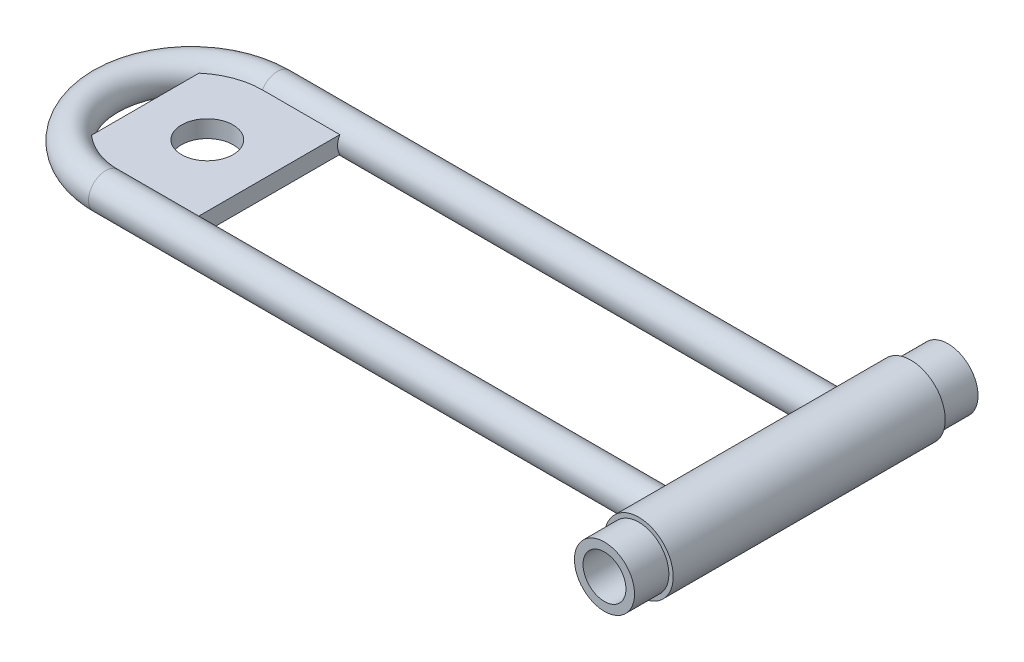
from build123d import *
from build123d.topology import SkipClean

# Parameters (mm, degrees)
SKETCH1_R           = 6.35
SKETCH1_R_2         = 3.175
BOSS_EXTRUDE1_DEPTH = 62.992
SKETCH3_R           = 3.175
SKETCH6_W           = 22.86
SKETCH6_H           = 3.175
BOSS_EXTRUDE3_DEPTH = 29.21
SKETCH7_R           = 4.7625
CUT_EXTRUDE1_DEPTH  = 29.21
BOSS_EXTRUDE5_START = 6.35
SKETCH9_R           = 6.35
SKETCH9_R_2         = 3.175
BOSS_EXTRUDE5_DEPTH = 6.35
CUT_EXTRUDE6_START  = -12.7
SKETCH10_R          = 6.35
SKETCH10_R_2        = 5.55625
CUT_EXTRUDE6_DEPTH  = 12.7
SKETCH12_R          = 6.35
SKETCH12_R_2        = 5.55625
CUT_EXTRUDE7_DEPTH  = 12.7
CUT_EXTRUDE8_START  = -6.35
SKETCH13_R          = 5.55625
SKETCH13_R_2        = 3.175
CUT_EXTRUDE8_DEPTH  = 6.35
SKETCH14_R          = 5.55625
SKETCH14_R_2        = 3.175
CUT_EXTRUDE9_DEPTH  = 6.35
SKETCH16_R          = 3.96875
CUT_EXTRUDE11_DEPTH = 142.896915114
BOSS_EXTRUDE7_START = 0.508
SKETCH18_R          = 5.55625
SKETCH18_R_2        = 3.96875
BOSS_EXTRUDE7_DEPTH = 0.508


with BuildPart() as part:
    # Sketch1 → Boss-Extrude1 (new body)
    with BuildSketch(Plane.XY):
        Circle(SKETCH1_R)
        Circle(SKETCH1_R_2, mode=Mode.SUBTRACT)
    extrude(amount=BOSS_EXTRUDE1_DEPTH)

    # Sweep1: sweep along a path in Sketch4
    with BuildLine(Plane(origin=(0, 0, 0), x_dir=(1, 0, 0), z_dir=(0, 1, 0))) as sweep1_path:
        Line((-3.81, -15.663931971), (-107.95, -15.663931971))
        ThreePointArc((-107.95, -15.663931971), (-123.665226198, -31.37915817), (-107.95, -47.094384368))
        Line((-107.95, -47.094384368), (-3.81, -47.094384368))
    # Sketch3 → Sweep1 (sweep)
    with BuildSketch(Plane.ZY.offset(3.81)):
        with Locations((47.244, 0)):
            Circle(SKETCH3_R)
    sweep(path=sweep1_path.line)

    # Sketch6 → Boss-Extrude3 (add)
    with BuildSketch(Plane.XY.offset(15.24)):
        with Locations((-105.071320577, 0)):
            Rectangle(SKETCH6_W, SKETCH6_H)
    extrude(amount=BOSS_EXTRUDE3_DEPTH)

    # Sketch7 → Cut-Extrude1 (cut)
    with BuildSketch(Plane(origin=(0, 1.5875, 0), x_dir=(1, 0, 0), z_dir=(0, 1, 0))):
        with Locations((-105.071320577, -31.341130791)):
            Circle(SKETCH7_R)
    extrude(amount=-CUT_EXTRUDE1_DEPTH, mode=Mode.SUBTRACT)

    # Sketch9 → Boss-Extrude5 (add)
    with BuildSketch(Plane(origin=(0, 0, 0), x_dir=(-1, 0, 0), z_dir=(0, 0, -1)).offset(BOSS_EXTRUDE5_START)):
        Circle(SKETCH9_R)
        Circle(SKETCH9_R_2, mode=Mode.SUBTRACT)
    boss_extrude5 = extrude(amount=-BOSS_EXTRUDE5_DEPTH)

    # Mirror1: Boss-Extrude5 across plane
    with SkipClean():  # the faces are left unmerged after this step: merging them gives an invalid solid
        add(boss_extrude5.mirror(Plane.XY.offset(31.496)))

    # Sketch10 → Cut-Extrude6 (cut)
    with BuildSketch(Plane.XY.offset(69.342).offset(CUT_EXTRUDE6_START)):
        Circle(SKETCH10_R)
        Circle(SKETCH10_R_2, mode=Mode.SUBTRACT)
    extrude(amount=CUT_EXTRUDE6_DEPTH, mode=Mode.SUBTRACT)

    # Sketch12 → Cut-Extrude7 (cut)
    with BuildSketch(Plane(origin=(0, 0, -6.35), x_dir=(-1, 0, 0), z_dir=(0, 0, -1))):
        Circle(SKETCH12_R)
        Circle(SKETCH12_R_2, mode=Mode.SUBTRACT)
    extrude(amount=-CUT_EXTRUDE7_DEPTH, mode=Mode.SUBTRACT)

    # Sketch13 → Cut-Extrude8 (cut)
    with BuildSketch(Plane.XY.offset(69.342).offset(CUT_EXTRUDE8_START)):
        Circle(SKETCH13_R)
        Circle(SKETCH13_R_2, mode=Mode.SUBTRACT)
    extrude(amount=CUT_EXTRUDE8_DEPTH, mode=Mode.SUBTRACT)

    # Sketch14 → Cut-Extrude9 (cut)
    with BuildSketch(Plane(origin=(0, 0, -6.35), x_dir=(-1, 0, 0), z_dir=(0, 0, -1))):
        Circle(SKETCH14_R)
        Circle(SKETCH14_R_2, mode=Mode.SUBTRACT)
    extrude(amount=-CUT_EXTRUDE9_DEPTH, mode=Mode.SUBTRACT)

    # Sketch16 → Cut-Extrude11 (cut, through all)
    with BuildSketch(Plane(origin=(0, 0, 0), x_dir=(-1, 0, 0), z_dir=(0, 0, -1))):
        Circle(SKETCH16_R)
    extrude(amount=-CUT_EXTRUDE11_DEPTH, mode=Mode.SUBTRACT)

    # Sketch18 → Boss-Extrude7 (add)
    with BuildSketch(Plane(origin=(0, 0, 0), x_dir=(-1, 0, 0), z_dir=(0, 0, -1)).offset(BOSS_EXTRUDE7_START)):
        Circle(SKETCH18_R)
        Circle(SKETCH18_R_2, mode=Mode.SUBTRACT)
    extrude(amount=-BOSS_EXTRUDE7_DEPTH)


solid = part.part
